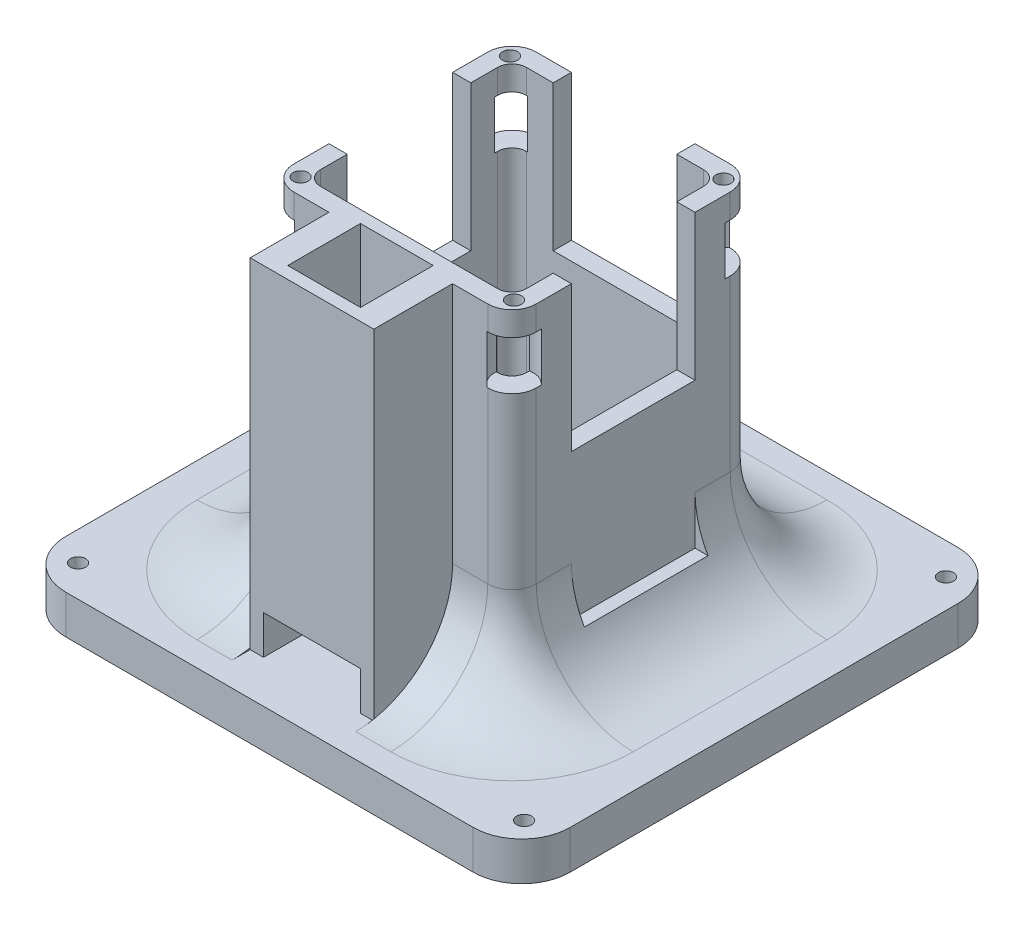
from build123d import *

# Parameters (mm, degrees)
SKETCH1_W               = 104
SKETCH1_H               = 100
BOSS_EXTRUDE1_DEPTH     = 8
FILLET1_R               = 10
SKETCH2_R               = 1.55
CUT_EXTRUDE1_DEPTH      = 10
SKETCH3_W               = 50
SKETCH3_H               = 50
SKETCH3_W_2             = 42.5
SKETCH3_H_2             = 42.5
BOSS_EXTRUDE2_DEPTH     = 70
FILLET2_R               = 5
FILLET3_R               = 3
SKETCH4_W               = 25.5
SKETCH4_H               = 3.75
SKETCH4_W_2             = 3.75
SKETCH4_H_2             = 25.5
CUT_EXTRUDE2_DEPTH      = 70
SKETCH5_R               = 1.55
CUT_EXTRUDE3_DEPTH      = 5
SKETCH6_R               = 4
CUT_EXTRUDE4_DEPTH      = 10
MIRROR4_COPY_1_SKETCH_R = 1.55
MIRROR4_COPY_1_DEPTH    = 5
MIRROR4_COPY_2_SKETCH_R = 4
MIRROR4_COPY_2_DEPTH    = 10
SKETCH7_W               = 25.5
SKETCH7_H               = 3.75
SKETCH7_W_2             = 3.75
SKETCH7_H_2             = 25.5
BOSS_EXTRUDE3_DEPTH     = 10
FILLET4_R               = 20
SKETCH8_W               = 3.75
SKETCH8_H               = 25.5
SKETCH8_W_2             = 25.5
SKETCH8_H_2             = 3.75
BOSS_EXTRUDE4_DEPTH     = 30
SKETCH9_W               = 25.5
SKETCH9_H               = 20
BOSS_EXTRUDE5_DEPTH     = 70
SKETCH10_W              = 20
SKETCH10_H              = 8
CUT_EXTRUDE5_DEPTH      = 30
SKETCH11_W              = 15
SKETCH11_H              = 15
CUT_EXTRUDE6_DEPTH      = 70


with BuildPart() as part:
    # Sketch1 → Boss-Extrude1 (new body)
    with BuildSketch(Plane(origin=(0, 0, 0), x_dir=(1, 0, 0), z_dir=(0, 1, 0))):
        Rectangle(SKETCH1_W, SKETCH1_H)
    extrude(amount=BOSS_EXTRUDE1_DEPTH)

    # Fillet1
    fillet1_edges = [part.edges().sort_by_distance(p)[0] for p in [
        (52, 4, 50),
        (-52, 4, 50),
        (-52, 4, -50),
        (52, 4, -50),
    ]]
    fillet(fillet1_edges, radius=FILLET1_R)

    # Sketch2 → Cut-Extrude1 (cut)
    with BuildSketch(Plane(origin=(0, 8, 0), x_dir=(1, 0, 0), z_dir=(0, 1, 0))):
        with Locations(Location((-46, 43.5, 0), (0, 0, 270))):
            Circle(SKETCH2_R)
        with Locations(Location((46, 43.5, 0), (0, 0, 270))):
            Circle(SKETCH2_R)
        with Locations(Location((46, -43.5, 0), (0, 0, 270))):
            Circle(SKETCH2_R)
        with Locations(Location((-46, -43.5, 0), (0, 0, 270))):
            Circle(SKETCH2_R)
    extrude(amount=-CUT_EXTRUDE1_DEPTH, mode=Mode.SUBTRACT)

    # Sketch3 → Boss-Extrude2 (add)
    with BuildSketch(Plane(origin=(0, 8, 0), x_dir=(1, 0, 0), z_dir=(0, 1, 0))):
        Rectangle(SKETCH3_W, SKETCH3_H)
        Rectangle(SKETCH3_W_2, SKETCH3_H_2, mode=Mode.SUBTRACT)
    extrude(amount=BOSS_EXTRUDE2_DEPTH)

    # Fillet2
    fillet2_edges = [part.edges().sort_by_distance(p)[0] for p in [
        (25, 43, 25),
        (25, 43, -25),
        (-25, 43, -25),
        (-25, 43, 25),
    ]]
    fillet(fillet2_edges, radius=FILLET2_R)

    # Fillet3
    fillet3_edges = [part.edges().sort_by_distance(p)[0] for p in [
        (21.25, 43, -21.25),
        (-21.25, 43, -21.25),
        (-21.25, 43, 21.25),
        (21.25, 43, 21.25),
    ]]
    fillet(fillet3_edges, radius=FILLET3_R)

    # Sketch4 → Cut-Extrude2 (cut)
    with BuildSketch(Plane(origin=(0, 78, 0), x_dir=(1, 0, 0), z_dir=(0, 1, 0))):
        with Locations((0, 23.125)):
            Rectangle(SKETCH4_W, SKETCH4_H)
        with Locations((-23.125, 0)):
            Rectangle(SKETCH4_W_2, SKETCH4_H_2)
    cut_extrude2 = extrude(amount=-CUT_EXTRUDE2_DEPTH, mode=Mode.SUBTRACT)

    # Mirror1: Cut-Extrude2 across plane
    add(cut_extrude2.mirror(Plane.XY), mode=Mode.SUBTRACT)

    # Mirror2: Cut-Extrude2 across plane
    add(cut_extrude2.mirror(Plane(origin=(0, 0, 0), x_dir=(0, 0, 1), z_dir=(1, 0, 0))), mode=Mode.SUBTRACT)

    # Sketch5 → Cut-Extrude3 (cut)
    with BuildSketch(Plane(origin=(0, 78, 0), x_dir=(1, 0, 0), z_dir=(0, 1, 0))):
        with Locations(Location((-22, 21.6, 0), (0, 0, 270))):
            Circle(SKETCH5_R)
    cut_extrude3 = extrude(amount=-CUT_EXTRUDE3_DEPTH, mode=Mode.SUBTRACT)

    # Sketch6 → Cut-Extrude4 (cut)
    with BuildSketch(Plane(origin=(0, 73, 0), x_dir=(1, 0, 0), z_dir=(0, 1, 0))):
        with Locations((-22, 21.6)):
            Circle(SKETCH6_R)
    cut_extrude4 = extrude(amount=-CUT_EXTRUDE4_DEPTH, mode=Mode.SUBTRACT)

    # Mirror3: Cut-Extrude3, Cut-Extrude4 across plane
    add(cut_extrude3.mirror(Plane(origin=(0, 0, 0), x_dir=(0, 0, 1), z_dir=(1, 0, 0))), mode=Mode.SUBTRACT)
    add(cut_extrude4.mirror(Plane(origin=(0, 0, 0), x_dir=(0, 0, 1), z_dir=(1, 0, 0))), mode=Mode.SUBTRACT)

    # Mirror4: Cut-Extrude3, Cut-Extrude4 across plane
    add(cut_extrude3.mirror(Plane.XY), mode=Mode.SUBTRACT)
    add(cut_extrude4.mirror(Plane.XY), mode=Mode.SUBTRACT)

    # Mirror4 copy 1 sketch → Mirror4 copy 1 (cut)
    with BuildSketch(Plane(origin=(0, 78, 0), x_dir=(-1, 0, 0), z_dir=(0, 1, 0))):
        with Locations(Location((-22, 21.6, 0), (0, 0, 270))):
            Circle(MIRROR4_COPY_1_SKETCH_R)
    extrude(amount=-MIRROR4_COPY_1_DEPTH, mode=Mode.SUBTRACT)

    # Mirror4 copy 2 sketch → Mirror4 copy 2 (cut)
    with BuildSketch(Plane(origin=(0, 73, 0), x_dir=(-1, 0, 0), z_dir=(0, 1, 0))):
        with Locations((-22, 21.6)):
            Circle(MIRROR4_COPY_2_SKETCH_R)
    extrude(amount=-MIRROR4_COPY_2_DEPTH, mode=Mode.SUBTRACT)

    # Sketch7 → Boss-Extrude3 (add)
    with BuildSketch(Plane(origin=(0, 8, 0), x_dir=(1, 0, 0), z_dir=(0, 1, 0))):
        with Locations((0, 23.125)):
            Rectangle(SKETCH7_W, SKETCH7_H)
        with Locations((-23.125, 0)):
            Rectangle(SKETCH7_W_2, SKETCH7_H_2)
        with Locations((23.125, 0)):
            Rectangle(SKETCH7_W_2, SKETCH7_H_2)
    extrude(amount=BOSS_EXTRUDE3_DEPTH)

    # Fillet4
    # the kernel refuses this fillet: 20 mm, written as the material it adds along each edge
    with BuildSketch(Plane(origin=(12.75, 8, 25), x_dir=(0, 0, 1), z_dir=(1, 0, 0)), Plane(origin=(-20, 8, 25), x_dir=(0, 0, 1), z_dir=(1, 0, 0))) as fillet4_piece_1:
        with BuildLine():
            CenterArc((FILLET4_R, -FILLET4_R), FILLET4_R, 90, 90)
            Line((0, -FILLET4_R), (0, 0))
            Line((0, 0), (FILLET4_R, 0))
        make_face()
    extrude(amount=7.25)
    with BuildSketch(Plane(origin=(20, 8, 20), x_dir=(0, 0, 1), z_dir=(-1, 0, 0))) as fillet4_piece_2:
        with BuildLine():
            CenterArc((5 + FILLET4_R, FILLET4_R), FILLET4_R, 180, 90)
            Line((5, FILLET4_R), (5, 0))
            Line((5, 0), (5 + FILLET4_R, 0))
        make_face()
    revolve(axis=Axis((20, 8, 20), (0, 1, 0)), revolution_arc=90)
    with BuildSketch(Plane(origin=(25, 8, -20), x_dir=(1, 0, 0), z_dir=(0, 0, 1))) as fillet4_piece_3_section:
        with BuildLine():
            CenterArc((FILLET4_R, FILLET4_R), FILLET4_R, 180, 90)
            Line((0, FILLET4_R), (0, 0))
            Line((0, 0), (FILLET4_R, 0))
        make_face()
    fillet4_piece_3 = extrude(amount=40, mode=Mode.PRIVATE)
    fillet4_piece_3 = split(fillet4_piece_3, bisect_by=Plane(origin=(30.102401199, 11.287835286, -12.75), z_dir=(0, 0, -1)), keep=Keep.TOP, mode=Mode.PRIVATE)
    fillet4_piece_3 = split(fillet4_piece_3, bisect_by=Plane(origin=(30.102401199, 18, -16.375), z_dir=(0, -1, 0)), keep=Keep.TOP, mode=Mode.PRIVATE)
    add(fillet4_piece_3)
    with BuildSketch(Plane(origin=(25, 8, -20), x_dir=(1, 0, 0), z_dir=(0, 0, 1))) as fillet4_piece_4_section:
        with BuildLine():
            CenterArc((FILLET4_R, FILLET4_R), FILLET4_R, 180, 90)
            Line((0, FILLET4_R), (0, 0))
            Line((0, 0), (FILLET4_R, 0))
        make_face()
    fillet4_piece_4 = extrude(amount=40, mode=Mode.PRIVATE)
    fillet4_piece_4 = split(fillet4_piece_4, bisect_by=Plane(origin=(25.480167634, 21.26501569, -12.75), z_dir=(0, 0, -1)), keep=Keep.TOP, mode=Mode.PRIVATE)
    fillet4_piece_4 = split(fillet4_piece_4, bisect_by=Plane(origin=(25.480167634, 18, -16.375), z_dir=(0, 1, 0)), keep=Keep.TOP, mode=Mode.PRIVATE)
    add(fillet4_piece_4)
    with BuildSketch(Plane(origin=(25, 8, -20), x_dir=(1, 0, 0), z_dir=(0, 0, 1))) as fillet4_piece_5_section:
        with BuildLine():
            CenterArc((FILLET4_R, FILLET4_R), FILLET4_R, 180, 90)
            Line((0, FILLET4_R), (0, 0))
            Line((0, 0), (FILLET4_R, 0))
        make_face()
    fillet4_piece_5 = extrude(amount=40, mode=Mode.PRIVATE)
    fillet4_piece_5 = split(fillet4_piece_5, bisect_by=Plane(origin=(30.102401199, 11.287835286, -12.75), z_dir=(0, 0, 1)), keep=Keep.TOP, mode=Mode.PRIVATE)
    fillet4_piece_5 = split(fillet4_piece_5, bisect_by=Plane(origin=(30.102401199, 18, 0), z_dir=(0, -1, 0)), keep=Keep.TOP, mode=Mode.PRIVATE)
    fillet4_piece_5 = split(fillet4_piece_5, bisect_by=Plane(origin=(30.102401199, 11.287835286, 12.75), z_dir=(0, 0, -1)), keep=Keep.TOP, mode=Mode.PRIVATE)
    add(fillet4_piece_5)
    with BuildSketch(Plane(origin=(25, 8, -20), x_dir=(1, 0, 0), z_dir=(0, 0, 1))) as fillet4_piece_6_section:
        with BuildLine():
            CenterArc((FILLET4_R, FILLET4_R), FILLET4_R, 180, 90)
            Line((0, FILLET4_R), (0, 0))
            Line((0, 0), (FILLET4_R, 0))
        make_face()
    fillet4_piece_6 = extrude(amount=40, mode=Mode.PRIVATE)
    fillet4_piece_6 = split(fillet4_piece_6, bisect_by=Plane(origin=(30.102401199, 18, 16.375), z_dir=(0, -1, 0)), keep=Keep.TOP, mode=Mode.PRIVATE)
    fillet4_piece_6 = split(fillet4_piece_6, bisect_by=Plane(origin=(30.102401199, 11.287835286, 12.75), z_dir=(0, 0, 1)), keep=Keep.TOP, mode=Mode.PRIVATE)
    add(fillet4_piece_6)
    with BuildSketch(Plane(origin=(25, 8, -20), x_dir=(1, 0, 0), z_dir=(0, 0, 1))) as fillet4_piece_7_section:
        with BuildLine():
            CenterArc((FILLET4_R, FILLET4_R), FILLET4_R, 180, 90)
            Line((0, FILLET4_R), (0, 0))
            Line((0, 0), (FILLET4_R, 0))
        make_face()
    fillet4_piece_7 = extrude(amount=40, mode=Mode.PRIVATE)
    fillet4_piece_7 = split(fillet4_piece_7, bisect_by=Plane(origin=(25.480167634, 18, 16.375), z_dir=(0, 1, 0)), keep=Keep.TOP, mode=Mode.PRIVATE)
    fillet4_piece_7 = split(fillet4_piece_7, bisect_by=Plane(origin=(25.480167634, 21.26501569, 12.75), z_dir=(0, 0, 1)), keep=Keep.TOP, mode=Mode.PRIVATE)
    add(fillet4_piece_7)
    with BuildSketch(Plane(origin=(20, 8, -20), x_dir=(1, 0, 0), z_dir=(0, 0, 1))) as fillet4_piece_8:
        with BuildLine():
            CenterArc((5 + FILLET4_R, FILLET4_R), FILLET4_R, 180, 90)
            Line((5, FILLET4_R), (5, 0))
            Line((5, 0), (5 + FILLET4_R, 0))
        make_face()
    revolve(axis=Axis((20, 8, -20), (0, 1, 0)), revolution_arc=90)
    with BuildSketch(Plane(origin=(20, 8, -25), x_dir=(0, 0, -1), z_dir=(-1, 0, 0))) as fillet4_piece_9_section:
        with BuildLine():
            CenterArc((FILLET4_R, -FILLET4_R), FILLET4_R, 90, 90)
            Line((0, -FILLET4_R), (0, 0))
            Line((0, 0), (FILLET4_R, 0))
        make_face()
    fillet4_piece_9 = extrude(amount=40, mode=Mode.PRIVATE)
    fillet4_piece_9 = split(fillet4_piece_9, bisect_by=Plane(origin=(12.75, 11.287835286, -30.102401199), z_dir=(1, 0, 0)), keep=Keep.TOP, mode=Mode.PRIVATE)
    fillet4_piece_9 = split(fillet4_piece_9, bisect_by=Plane(origin=(16.375, 18, -30.102401199), z_dir=(0, -1, 0)), keep=Keep.TOP, mode=Mode.PRIVATE)
    add(fillet4_piece_9)
    with BuildSketch(Plane(origin=(20, 8, -25), x_dir=(0, 0, -1), z_dir=(-1, 0, 0))) as fillet4_piece_10_section:
        with BuildLine():
            CenterArc((FILLET4_R, -FILLET4_R), FILLET4_R, 90, 90)
            Line((0, -FILLET4_R), (0, 0))
            Line((0, 0), (FILLET4_R, 0))
        make_face()
    fillet4_piece_10 = extrude(amount=40, mode=Mode.PRIVATE)
    fillet4_piece_10 = split(fillet4_piece_10, bisect_by=Plane(origin=(12.75, 21.26501569, -25.480167634), z_dir=(1, 0, 0)), keep=Keep.TOP, mode=Mode.PRIVATE)
    fillet4_piece_10 = split(fillet4_piece_10, bisect_by=Plane(origin=(16.375, 18, -25.480167634), z_dir=(0, 1, 0)), keep=Keep.TOP, mode=Mode.PRIVATE)
    add(fillet4_piece_10)
    with BuildSketch(Plane(origin=(20, 8, -25), x_dir=(0, 0, -1), z_dir=(-1, 0, 0))) as fillet4_piece_11_section:
        with BuildLine():
            CenterArc((FILLET4_R, -FILLET4_R), FILLET4_R, 90, 90)
            Line((0, -FILLET4_R), (0, 0))
            Line((0, 0), (FILLET4_R, 0))
        make_face()
    fillet4_piece_11 = extrude(amount=40, mode=Mode.PRIVATE)
    fillet4_piece_11 = split(fillet4_piece_11, bisect_by=Plane(origin=(12.75, 11.287835286, -30.102401199), z_dir=(-1, 0, 0)), keep=Keep.TOP, mode=Mode.PRIVATE)
    fillet4_piece_11 = split(fillet4_piece_11, bisect_by=Plane(origin=(0, 18, -30.102401199), z_dir=(0, -1, 0)), keep=Keep.TOP, mode=Mode.PRIVATE)
    fillet4_piece_11 = split(fillet4_piece_11, bisect_by=Plane(origin=(-12.75, 11.287835286, -30.102401199), z_dir=(1, 0, 0)), keep=Keep.TOP, mode=Mode.PRIVATE)
    add(fillet4_piece_11)
    with BuildSketch(Plane(origin=(20, 8, -25), x_dir=(0, 0, -1), z_dir=(-1, 0, 0))) as fillet4_piece_12_section:
        with BuildLine():
            CenterArc((FILLET4_R, -FILLET4_R), FILLET4_R, 90, 90)
            Line((0, -FILLET4_R), (0, 0))
            Line((0, 0), (FILLET4_R, 0))
        make_face()
    fillet4_piece_12 = extrude(amount=40, mode=Mode.PRIVATE)
    fillet4_piece_12 = split(fillet4_piece_12, bisect_by=Plane(origin=(-16.375, 18, -30.102401199), z_dir=(0, -1, 0)), keep=Keep.TOP, mode=Mode.PRIVATE)
    fillet4_piece_12 = split(fillet4_piece_12, bisect_by=Plane(origin=(-12.75, 11.287835286, -30.102401199), z_dir=(-1, 0, 0)), keep=Keep.TOP, mode=Mode.PRIVATE)
    add(fillet4_piece_12)
    with BuildSketch(Plane(origin=(20, 8, -25), x_dir=(0, 0, -1), z_dir=(-1, 0, 0))) as fillet4_piece_13_section:
        with BuildLine():
            CenterArc((FILLET4_R, -FILLET4_R), FILLET4_R, 90, 90)
            Line((0, -FILLET4_R), (0, 0))
            Line((0, 0), (FILLET4_R, 0))
        make_face()
    fillet4_piece_13 = extrude(amount=40, mode=Mode.PRIVATE)
    fillet4_piece_13 = split(fillet4_piece_13, bisect_by=Plane(origin=(-16.375, 18, -25.480167634), z_dir=(0, 1, 0)), keep=Keep.TOP, mode=Mode.PRIVATE)
    fillet4_piece_13 = split(fillet4_piece_13, bisect_by=Plane(origin=(-12.75, 21.26501569, -25.480167634), z_dir=(-1, 0, 0)), keep=Keep.TOP, mode=Mode.PRIVATE)
    add(fillet4_piece_13)
    with BuildSketch(Plane(origin=(-20, 8, -20), x_dir=(0, 0, -1), z_dir=(1, 0, 0))) as fillet4_piece_14:
        with BuildLine():
            CenterArc((5 + FILLET4_R, FILLET4_R), FILLET4_R, 180, 90)
            Line((5, FILLET4_R), (5, 0))
            Line((5, 0), (5 + FILLET4_R, 0))
        make_face()
    revolve(axis=Axis((-20, 8, -20), (0, 1, 0)), revolution_arc=90)
    with BuildSketch(Plane(origin=(-20, 8, 20), x_dir=(0, 0, 1), z_dir=(1, 0, 0))) as fillet4_piece_15:
        with BuildLine():
            CenterArc((5 + FILLET4_R, -FILLET4_R), FILLET4_R, 90, 90)
            Line((5, -FILLET4_R), (5, 0))
            Line((5, 0), (5 + FILLET4_R, 0))
        make_face()
    revolve(axis=Axis((-20, 8, 20), (0, -1, 0)), revolution_arc=90)
    with BuildSketch(Plane(origin=(-25, 8, -20), x_dir=(-1, 0, 0), z_dir=(0, 0, 1))) as fillet4_piece_16_section:
        with BuildLine():
            CenterArc((FILLET4_R, -FILLET4_R), FILLET4_R, 90, 90)
            Line((0, -FILLET4_R), (0, 0))
            Line((0, 0), (FILLET4_R, 0))
        make_face()
    fillet4_piece_16 = extrude(amount=40, mode=Mode.PRIVATE)
    fillet4_piece_16 = split(fillet4_piece_16, bisect_by=Plane(origin=(-30.102401199, 18, -16.375), z_dir=(0, -1, 0)), keep=Keep.TOP, mode=Mode.PRIVATE)
    fillet4_piece_16 = split(fillet4_piece_16, bisect_by=Plane(origin=(-30.102401199, 11.287835286, -12.75), z_dir=(0, 0, -1)), keep=Keep.TOP, mode=Mode.PRIVATE)
    add(fillet4_piece_16)
    with BuildSketch(Plane(origin=(-25, 8, -20), x_dir=(-1, 0, 0), z_dir=(0, 0, 1))) as fillet4_piece_17_section:
        with BuildLine():
            CenterArc((FILLET4_R, -FILLET4_R), FILLET4_R, 90, 90)
            Line((0, -FILLET4_R), (0, 0))
            Line((0, 0), (FILLET4_R, 0))
        make_face()
    fillet4_piece_17 = extrude(amount=40, mode=Mode.PRIVATE)
    fillet4_piece_17 = split(fillet4_piece_17, bisect_by=Plane(origin=(-25.480167634, 18, -16.375), z_dir=(0, 1, 0)), keep=Keep.TOP, mode=Mode.PRIVATE)
    fillet4_piece_17 = split(fillet4_piece_17, bisect_by=Plane(origin=(-25.480167634, 21.26501569, -12.75), z_dir=(0, 0, -1)), keep=Keep.TOP, mode=Mode.PRIVATE)
    add(fillet4_piece_17)
    with BuildSketch(Plane(origin=(-25, 8, -20), x_dir=(-1, 0, 0), z_dir=(0, 0, 1))) as fillet4_piece_18_section:
        with BuildLine():
            CenterArc((FILLET4_R, -FILLET4_R), FILLET4_R, 90, 90)
            Line((0, -FILLET4_R), (0, 0))
            Line((0, 0), (FILLET4_R, 0))
        make_face()
    fillet4_piece_18 = extrude(amount=40, mode=Mode.PRIVATE)
    fillet4_piece_18 = split(fillet4_piece_18, bisect_by=Plane(origin=(-30.102401199, 11.287835286, 12.75), z_dir=(0, 0, -1)), keep=Keep.TOP, mode=Mode.PRIVATE)
    fillet4_piece_18 = split(fillet4_piece_18, bisect_by=Plane(origin=(-30.102401199, 18, 0), z_dir=(0, -1, 0)), keep=Keep.TOP, mode=Mode.PRIVATE)
    fillet4_piece_18 = split(fillet4_piece_18, bisect_by=Plane(origin=(-30.102401199, 11.287835286, -12.75), z_dir=(0, 0, 1)), keep=Keep.TOP, mode=Mode.PRIVATE)
    add(fillet4_piece_18)
    with BuildSketch(Plane(origin=(-25, 8, -20), x_dir=(-1, 0, 0), z_dir=(0, 0, 1))) as fillet4_piece_19_section:
        with BuildLine():
            CenterArc((FILLET4_R, -FILLET4_R), FILLET4_R, 90, 90)
            Line((0, -FILLET4_R), (0, 0))
            Line((0, 0), (FILLET4_R, 0))
        make_face()
    fillet4_piece_19 = extrude(amount=40, mode=Mode.PRIVATE)
    fillet4_piece_19 = split(fillet4_piece_19, bisect_by=Plane(origin=(-30.102401199, 11.287835286, 12.75), z_dir=(0, 0, 1)), keep=Keep.TOP, mode=Mode.PRIVATE)
    fillet4_piece_19 = split(fillet4_piece_19, bisect_by=Plane(origin=(-30.102401199, 18, 16.375), z_dir=(0, -1, 0)), keep=Keep.TOP, mode=Mode.PRIVATE)
    add(fillet4_piece_19)
    with BuildSketch(Plane(origin=(-25, 8, -20), x_dir=(-1, 0, 0), z_dir=(0, 0, 1))) as fillet4_piece_20_section:
        with BuildLine():
            CenterArc((FILLET4_R, -FILLET4_R), FILLET4_R, 90, 90)
            Line((0, -FILLET4_R), (0, 0))
            Line((0, 0), (FILLET4_R, 0))
        make_face()
    fillet4_piece_20 = extrude(amount=40, mode=Mode.PRIVATE)
    fillet4_piece_20 = split(fillet4_piece_20, bisect_by=Plane(origin=(-25.480167634, 21.26501569, 12.75), z_dir=(0, 0, 1)), keep=Keep.TOP, mode=Mode.PRIVATE)
    fillet4_piece_20 = split(fillet4_piece_20, bisect_by=Plane(origin=(-25.480167634, 18, 16.375), z_dir=(0, 1, 0)), keep=Keep.TOP, mode=Mode.PRIVATE)
    add(fillet4_piece_20)

    # Sketch8 → Boss-Extrude4 (add)
    with BuildSketch(Plane(origin=(0, 18, 0), x_dir=(1, 0, 0), z_dir=(0, 1, 0))):
        with Locations((-23.125, 0)):
            Rectangle(SKETCH8_W, SKETCH8_H)
        with Locations((0, 23.125)):
            Rectangle(SKETCH8_W_2, SKETCH8_H_2)
        with Locations((23.125, 0)):
            Rectangle(SKETCH8_W, SKETCH8_H)
    extrude(amount=BOSS_EXTRUDE4_DEPTH)

    # Sketch9 → Boss-Extrude5 (add)
    with BuildSketch(Plane(origin=(0, 8, 0), x_dir=(1, 0, 0), z_dir=(0, 1, 0))):
        with Locations((0, -31.25)):
            Rectangle(SKETCH9_W, SKETCH9_H)
    extrude(amount=BOSS_EXTRUDE5_DEPTH)

    # Sketch10 → Cut-Extrude5 (cut)
    with BuildSketch(Plane.XY.offset(41.25)):
        with Locations((0, 12)):
            Rectangle(SKETCH10_W, SKETCH10_H)
    extrude(amount=-CUT_EXTRUDE5_DEPTH, mode=Mode.SUBTRACT)

    # Sketch11 → Cut-Extrude6 (cut)
    with BuildSketch(Plane(origin=(0, 78, 0), x_dir=(1, 0, 0), z_dir=(0, 1, 0))):
        with Locations((0, -31.25)):
            Rectangle(SKETCH11_W, SKETCH11_H)
    extrude(amount=-CUT_EXTRUDE6_DEPTH, mode=Mode.SUBTRACT)


solid = part.part
